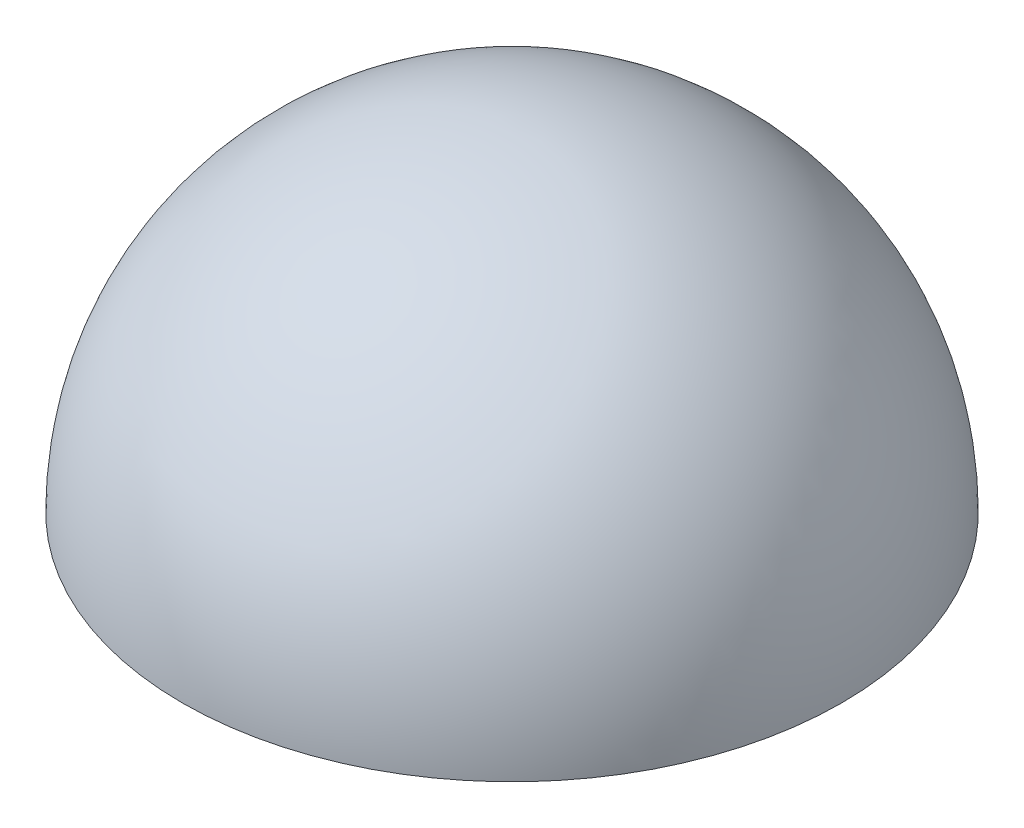
from build123d import *

# Parameters (mm, degrees)
CUT_EXTRUDE2_DEPTH      = 3.5
CUT_EXTRUDE4_DEPTH      = 2
SKETCH7_R               = 1
CUT_EXTRUDE6_DEPTH      = 7
CUT_EXTRUDE7_DEPTH      = 2.2
CUT_EXTRUDE8_DEPTH      = 12
CUT_EXTRUDE8_DEPTH_BACK = 2


with BuildPart() as part:
    # Sketch1 → Revolve1 (revolve)
    with BuildSketch(Plane.XY):
        with BuildLine():
            ThreePointArc((0, 14.4), (-10.182337649, 10.182337649), (-14.4, 0))
            Line((-14.4, 0), (0, 0))
            Line((0, 0), (0, 14.4))
        make_face()
    revolve(axis=Axis((0, -1000, 0), (0, 1, 0)))

    # Sketch2 → Cut-Extrude2 (cut)
    with BuildSketch(Plane.XZ):
        Polygon((4.878609775, -8.45), (9.757219549, 0), (4.878609775, 8.45), (-4.878609775, 8.45), (-9.757219549, 0), (-4.878609775, -8.45), align=None)
    extrude(amount=-CUT_EXTRUDE2_DEPTH, mode=Mode.SUBTRACT)

    # Sketch3 → Cut-Extrude4 (cut)
    with BuildSketch(Plane.XZ.offset(-3.5)):
        Polygon((3.723909236, -6.45), (7.447818473, 0), (3.723909236, 6.45), (-3.723909236, 6.45), (-7.447818473, 0), (-3.723909236, -6.45), align=None)
    extrude(amount=-CUT_EXTRUDE4_DEPTH, mode=Mode.SUBTRACT)

    # Sketch4 → Cut-Revolve1 (revolve, cut)
    with BuildSketch(Plane(origin=(0, 0, 0), x_dir=(0, 0, -1), z_dir=(1, 0, 0))):
        with BuildLine():
            Line((-6.45, 5.5), (0, 5.5))
            Line((0, 5.5), (0, 13.5))
            add(Edge.make_bspline(
                [(0, 13.5), (-6.45, 13.5), (-6.45, 5.5)],
                knots=[0, 0, 0, 1.570796327, 1.570796327, 1.570796327], degree=2, weights=[1, 0.707106781, 1]))
        make_face()
    revolve(axis=Axis((0, -1000, 0), (0, 1, 0)), mode=Mode.SUBTRACT)

    # Sketch7 → Cut-Extrude6 (cut)
    with BuildSketch(Plane.XZ):
        with Locations((-9.526279442, 5.5)):
            Circle(SKETCH7_R)
        with Locations((9.526279442, 5.5)):
            Circle(SKETCH7_R)
        with Locations((0, -11)):
            Circle(SKETCH7_R)
    extrude(amount=-CUT_EXTRUDE6_DEPTH, mode=Mode.SUBTRACT)

    # Sketch8 → Cut-Extrude7 (cut)
    with BuildSketch(Plane.XZ):
        Polygon((-8.400446417, 3.55), (-7.274613392, 5.5), (-8.400446417, 7.45), (-10.652112467, 7.45), (-11.777945491, 5.5), (-10.652112467, 3.55), align=None)
        Polygon((7.274613392, 5.5), (8.400446417, 3.55), (10.652112467, 3.55), (11.777945491, 5.5), (10.652112467, 7.45), (8.400446417, 7.45), align=None)
        Polygon((1.125833025, -9.05), (-1.125833025, -9.05), (-2.25166605, -11), (-1.125833025, -12.95), (1.125833025, -12.95), (2.25166605, -11), align=None)
    extrude(amount=-CUT_EXTRUDE7_DEPTH, mode=Mode.SUBTRACT)

    # Sketch9 → Cut-Extrude8 (cut, two sides: drawn at the far end of the back side and taken through both)
    with BuildSketch(Plane.XZ.offset(-3.5).offset(-CUT_EXTRUDE8_DEPTH_BACK)):
        Polygon((4.936344802, -8.55), (9.872689603, 0), (4.936344802, 8.55), (-4.936344802, 8.55), (-9.872689603, 0), (-4.936344802, -8.55), align=None)
    extrude(amount=CUT_EXTRUDE8_DEPTH + CUT_EXTRUDE8_DEPTH_BACK, mode=Mode.SUBTRACT)


solid = part.part
